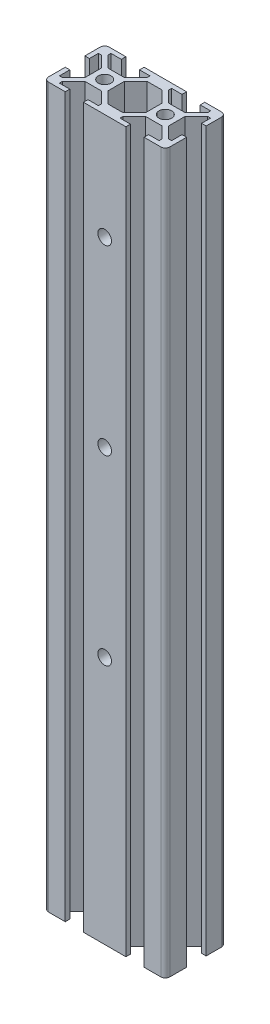
from build123d import *

# Parameters (mm, degrees)
SKETCH1_R            = 2.1
BOSS_EXTRUDE1_DEPTH  = 237
FILLET1_R            = 1.5
M4_CLEARANCE_HOLE1_D = 4.5


with BuildPart() as part:
    # Sketch1 → Boss-Extrude1 (new body)
    with BuildSketch(Plane(origin=(0, 0, 0), x_dir=(1, 0, 0), z_dir=(0, 1, 0))):
        Polygon((0, 0), (7, 0), (7, 1.5), (3.560660172, 1.5), (3.560660172, 2.5), (7.260660172, 6.2), (12.739339828, 6.2), (16.439339828, 2.5), (16.439339828, 1.5), (13, 1.5), (13, 0), (27, 0), (27, 1.5), (23.560660172, 1.5), (23.560660172, 2.5), (27.260660172, 6.2), (32.739339828, 6.2), (36.439339828, 2.5), (36.439339828, 1.5), (33, 1.5), (33, 0), (40, 0), (40, 7), (38.5, 7), (38.5, 3.560660172), (37.5, 3.560660172), (33.8, 7.260660172), (33.8, 12.739339828), (37.5, 16.439339828), (38.5, 16.439339828), (38.5, 13.45318801), (40, 13.45318801), (40, 20), (33, 20), (33, 18.5), (36.439339828, 18.5), (36.439339828, 17.5), (32.739339828, 13.8), (27.260660172, 13.8), (23.560660172, 17.5), (23.560660172, 18.5), (27, 18.5), (27, 20), (13, 20), (13, 18.5), (16.439339828, 18.5), (16.439339828, 17.5), (12.739339828, 13.8), (7.260660172, 13.8), (3.560660172, 17.5), (3.560660172, 18.5), (7, 18.5), (7, 20), (0, 20), (0, 13.45318801), (1.5, 13.45318801), (1.5, 16.439339828), (2.5, 16.439339828), (6.2, 12.739339828), (6.2, 7.260660172), (2.5, 3.560660172), (1.5, 3.560660172), (1.5, 7), (0, 7), align=None)
        with Locations((10, 10)):
            Circle(SKETCH1_R, mode=Mode.SUBTRACT)
        with Locations((30, 10)):
            Circle(SKETCH1_R, mode=Mode.SUBTRACT)
        Polygon((17.496963478, 16.458315541), (13.777987766, 12.739339828), (13.777987766, 7.260660172), (17.496963478, 3.541684459), (22.503036522, 3.541684459), (26.222012234, 7.260660172), (26.222012234, 12.739339828), (22.503036522, 16.458315541), align=None, mode=Mode.SUBTRACT)
    extrude(amount=BOSS_EXTRUDE1_DEPTH)

    # Fillet1
    fillet1_edges = [part.edges().sort_by_distance(p)[0] for p in [
        (0, 118.5, 0),
        (0, 118.5, -20),
        (40, 118.5, 0),
        (40, 118.5, -20),
    ]]
    fillet(fillet1_edges, radius=FILLET1_R)

    # M4 Clearance Hole1 (through all)
    with Locations(Plane.XY):
        with Locations((20, 202), (20, 142), (20, 82)):
            Hole(M4_CLEARANCE_HOLE1_D / 2)


solid = part.part
